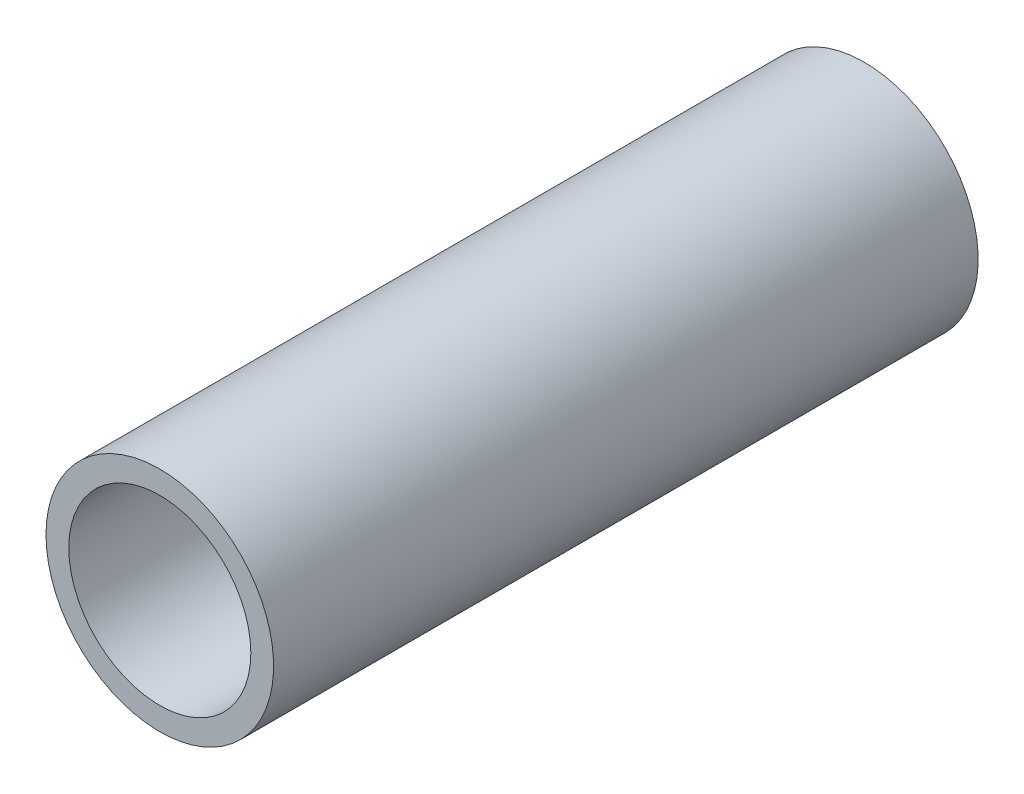
from build123d import *

# Parameters (mm, degrees)
SKETCH1_R           = 1.25
SKETCH1_R_2         = 1
BOSS_EXTRUDE1_DEPTH = 7.74


with BuildPart() as part:
    # Sketch1 → Boss-Extrude1 (new body)
    with BuildSketch(Plane.XY):
        Circle(SKETCH1_R)
        Circle(SKETCH1_R_2, mode=Mode.SUBTRACT)
    extrude(amount=BOSS_EXTRUDE1_DEPTH)


solid = part.part
